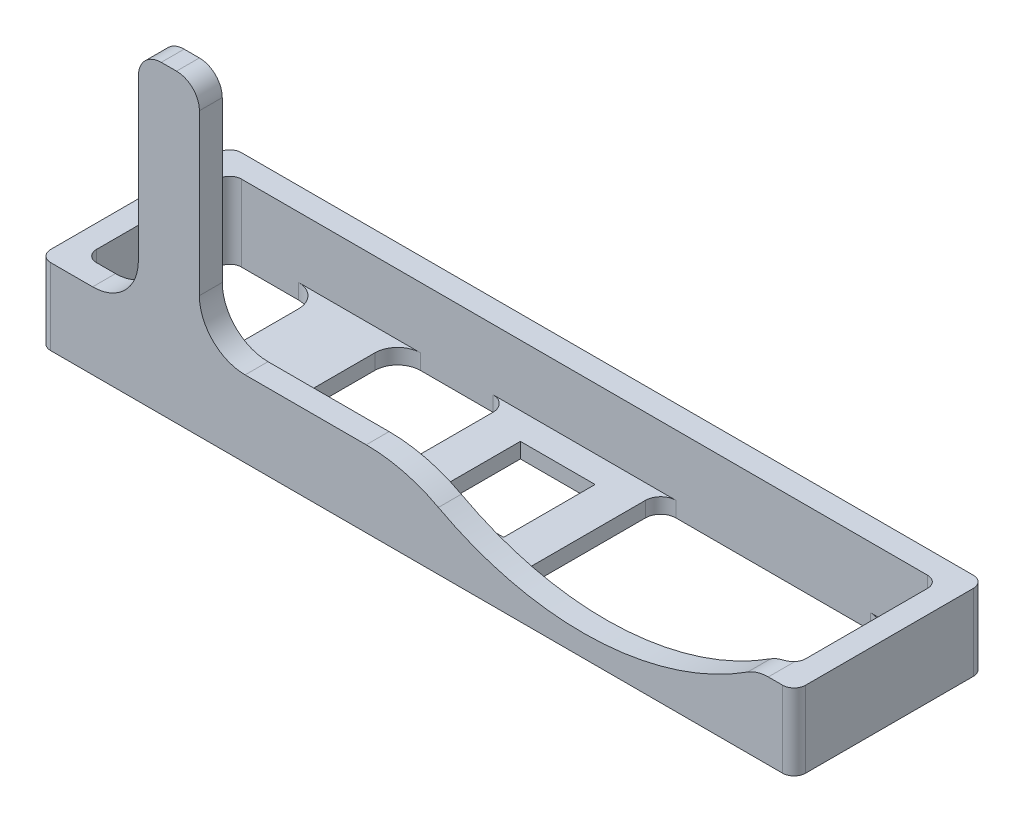
from build123d import *

# Parameters (mm, degrees)
SKETCH1_W               = 99
SKETCH1_H               = 25
SKETCH1_W_2             = 93
SKETCH1_H_2             = 19
BOSS_EXTRUDE1_DEPTH     = 10
SKETCH2_R               = 40
CUT_EXTRUDE1_DEPTH      = 8
SKETCH5_W               = 10
SKETCH5_H               = 25
BOSS_EXTRUDE5_DEPTH     = 2
SKETCH6_W               = 6
SKETCH6_H               = 19
BOSS_EXTRUDE6_DEPTH     = 2
SKETCH7_W               = 8
SKETCH7_H               = 3
BOSS_EXTRUDE7_DEPTH     = 30
FILLET5_R               = 3
FILLET7_R               = 5
FILLET8_R               = 20
FILLET9_R               = 1.5
FILLET10_R              = 6
FILLET11_R              = 3
SKETCH8_W               = 20
SKETCH8_H               = 25
BOSS_EXTRUDE8_DEPTH     = 2
SKETCH9_W               = 9.8
SKETCH9_H               = 12
BOSS_EXTRUDE9_DEPTH     = 10
SKETCH10_R              = 2
CUT_EXTRUDE2_DEPTH      = 23
FILLET12_R              = 6
CUT_EXTRUDE5_DEPTH      = 65.857536204
CUT_EXTRUDE5_DEPTH_BACK = 65.857536204
SKETCH12_W              = 9.8
SKETCH12_H              = 12
FILLET13_R              = 2


with BuildPart() as part:
    # Sketch1 → Boss-Extrude1 (new body)
    with BuildSketch(Plane(origin=(0, 0, 0), x_dir=(1, 0, 0), z_dir=(0, 1, 0))):
        Rectangle(SKETCH1_W, SKETCH1_H)
        Rectangle(SKETCH1_W_2, SKETCH1_H_2, mode=Mode.SUBTRACT)
    extrude(amount=BOSS_EXTRUDE1_DEPTH)

    # Sketch2 → Cut-Extrude1 (cut)
    with BuildSketch(Plane.XY.offset(12.5)):
        with Locations((21.780912994, 42.853113242)):
            Circle(SKETCH2_R)
    extrude(amount=-CUT_EXTRUDE1_DEPTH, mode=Mode.SUBTRACT)

    # Sketch5 → Boss-Extrude5 (add)
    with BuildSketch(Plane.XZ):
        with Locations((-29.5, 0)):
            Rectangle(SKETCH5_W, SKETCH5_H)
    extrude(amount=-BOSS_EXTRUDE5_DEPTH)

    # Sketch6 → Boss-Extrude6 (add)
    with BuildSketch(Plane.XZ):
        with Locations((43.5, 0)):
            Rectangle(SKETCH6_W, SKETCH6_H)
    extrude(amount=-BOSS_EXTRUDE6_DEPTH)

    # Sketch7 → Boss-Extrude7 (add)
    with BuildSketch(Plane(origin=(0, 10, 0), x_dir=(1, 0, 0), z_dir=(0, 1, 0))):
        with Locations((-32.5, -11)):
            Rectangle(SKETCH7_W, SKETCH7_H)
    extrude(amount=BOSS_EXTRUDE7_DEPTH)

    # Fillet5
    fillet5_edges = [part.edges().sort_by_distance(p)[0] for p in [
        (-34.5, 1, 9.5),
        (-24.5, 1, 9.5),
        (-24.5, 1, -9.5),
        (-34.5, 1, -9.5),
        (40.5, 1, -9.5),
        (40.5, 1, 9.5),
    ]]
    fillet(fillet5_edges, radius=FILLET5_R)

    # Fillet7
    fillet7_edges = [part.edges().sort_by_distance(p)[0] for p in [
        (44.599172136, 10, 11),
    ]]
    fillet(fillet7_edges, radius=FILLET7_R)

    # Fillet8
    fillet8_edges = [part.edges().sort_by_distance(p)[0] for p in [
        (-1.037346149, 10, 11),
    ]]
    fillet(fillet8_edges, radius=FILLET8_R)

    # Fillet9
    fillet9_edges = [part.edges().sort_by_distance(p)[0] for p in [
        (46.5, 6, 9.5),
        (46.5, 6, -9.5),
        (-46.5, 5, -9.5),
        (-46.5, 5, 9.5),
        (-49.5, 5, 12.5),
        (-49.5, 5, -12.5),
        (49.5, 5, -12.5),
        (49.5, 5, 12.5),
    ]]
    fillet(fillet9_edges, radius=FILLET9_R)

    # Fillet10
    fillet10_edges = [part.edges().sort_by_distance(p)[0] for p in [
        (-36.5, 10, 11),
        (-28.5, 10, 11),
    ]]
    fillet(fillet10_edges, radius=FILLET10_R)

    # Fillet11
    fillet11_edges = [part.edges().sort_by_distance(p)[0] for p in [
        (-36.5, 40, 11),
        (-28.5, 40, 11),
    ]]
    fillet(fillet11_edges, radius=FILLET11_R)

    # Sketch8 → Boss-Extrude8 (add)
    with BuildSketch(Plane.XZ):
        Rectangle(SKETCH8_W, SKETCH8_H)
    extrude(amount=-BOSS_EXTRUDE8_DEPTH)

    # Sketch9 → Boss-Extrude9 (add)
    with BuildSketch(Plane.XZ):
        Rectangle(SKETCH9_W, SKETCH9_H)
    extrude(amount=BOSS_EXTRUDE9_DEPTH)

    # Sketch10 → Cut-Extrude2 (cut)
    with BuildSketch(Plane(origin=(4.9, 0, 0), x_dir=(0, 0, -1), z_dir=(1, 0, 0))):
        with Locations((0, -5)):
            Circle(SKETCH10_R)
    extrude(amount=-CUT_EXTRUDE2_DEPTH, mode=Mode.SUBTRACT)

    # Fillet12
    fillet12_edges = [part.edges().sort_by_distance(p)[0] for p in [
        (0, -10, 6),
        (0, -10, -6),
    ]]
    fillet(fillet12_edges, radius=FILLET12_R - 0.0001)  # a hair under: the kernel refuses the full size

    # Sketch12 → Cut-Extrude5 (cut, two sides: drawn at the far end of the back side and taken through both)
    with BuildSketch(Plane.XZ.offset(-CUT_EXTRUDE5_DEPTH_BACK)):
        Rectangle(SKETCH12_W, SKETCH12_H)
    extrude(amount=CUT_EXTRUDE5_DEPTH + CUT_EXTRUDE5_DEPTH_BACK, mode=Mode.SUBTRACT)

    # Fillet13
    fillet13_edges = [part.edges().sort_by_distance(p)[0] for p in [
        (-10, 1, 9.5),
        (10, 1, 9.5),
        (10, 1, -9.5),
        (-10, 1, -9.5),
    ]]
    fillet(fillet13_edges, radius=FILLET13_R)


solid = part.part
